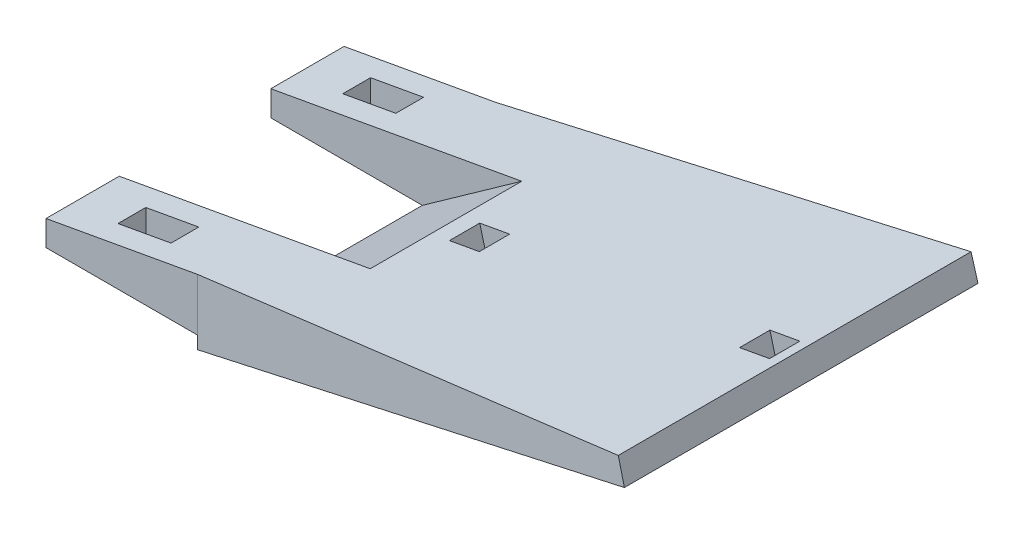
from build123d import *

# Parameters (mm, degrees)
SALIENTE_EXTRUIR1_DEPTH    = 70
CORTAR_EXTRUIR1_DEPTH      = 118.04418401
CORTAR_EXTRUIR1_DEPTH_BACK = 118.04418401
CROQUIS2_W                 = 30
CROQUIS2_H                 = 30
CROQUIS2_W_2               = 10.5
CROQUIS2_H_2               = 5.5
CROQUIS3_W                 = 6
CROQUIS3_H                 = 6
CORTAR_EXTRUIR2_DEPTH      = 118.634247959
CORTAR_EXTRUIR3_DEPTH      = 15
CORTAR_EXTRUIR3_DEPTH_BACK = 15


with BuildPart() as part:
    # Croquis1 → Saliente-Extruir1 (new body)
    with BuildSketch(Plane.XY):
        Polygon((0, 0), (90, 24.115427319), (88.705904774, 28.94505645), (-30, 7.5), (-30, 2.5), (0, 2.5), align=None)
    extrude(amount=SALIENTE_EXTRUIR1_DEPTH)

    # Croquis2 → Cortar-Extruir1 (cut, two sides: drawn at the far end of the back side and taken through both)
    with BuildSketch(Plane.XZ.offset(-2.5).offset(-CORTAR_EXTRUIR1_DEPTH_BACK)):
        Polygon((-30, 70), (-30, 64.5), (0, 64.5), (90, 70), align=None)
        with Locations((-15, 35)):
            Rectangle(CROQUIS2_W, CROQUIS2_H)
        Polygon((0, 5.5), (-30, 5.5), (-30, 0), (90, 0), align=None)
        with Locations((-15, 12.75)):
            Rectangle(CROQUIS2_W_2, CROQUIS2_H_2)
        with Locations((-15, 57.25)):
            Rectangle(CROQUIS2_W_2, CROQUIS2_H_2)
    extrude(amount=CORTAR_EXTRUIR1_DEPTH + CORTAR_EXTRUIR1_DEPTH_BACK, mode=Mode.SUBTRACT)

    # Croquis3 → Cortar-Extruir2 (cut, through all)
    with BuildSketch(Plane(origin=(0, 0, 0), x_dir=(0.9659258262890692, 0.2588190451025179, 0), z_dir=(0.2588190451025179, -0.9659258262890692, 0))):
        with Locations((30, 35)):
            Rectangle(CROQUIS3_W, CROQUIS3_H)
        with Locations((88.174856237, 35)):
            Rectangle(CROQUIS3_W, CROQUIS3_H)
    extrude(amount=-CORTAR_EXTRUIR2_DEPTH, mode=Mode.SUBTRACT)

    # Croquis4 → Cortar-Extruir3 (cut, two sides: drawn at the far end of the back side and taken through both)
    with BuildSketch(Plane.XY.offset(35).offset(-CORTAR_EXTRUIR3_DEPTH_BACK)):
        Polygon((0, 2.5), (0, 12.919710963), (19.681407906, 16.475295703), align=None)
    extrude(amount=CORTAR_EXTRUIR3_DEPTH + CORTAR_EXTRUIR3_DEPTH_BACK, mode=Mode.SUBTRACT)


solid = part.part
